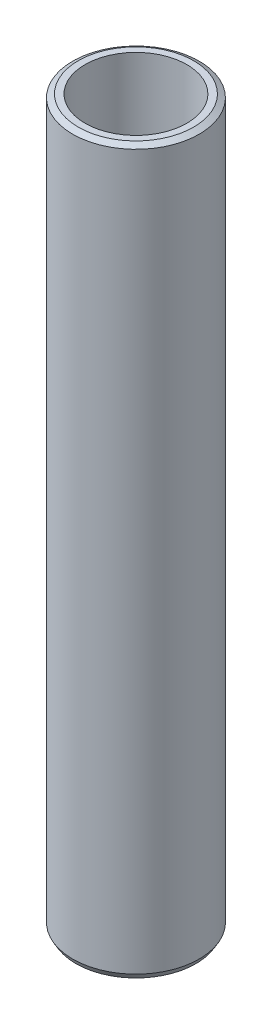
from build123d import *
from OCP.BRepFilletAPI import BRepFilletAPI_MakeChamfer

# Parameters (mm, degrees)
SKETCH1_R           = 52.5
BOSS_EXTRUDE1_DEPTH = 600
SKETCH2_R           = 42.214753031
CUT_EXTRUDE1_DEPTH  = 605.576297914
CHAMFER1_SIZE       = 2.701675338
CHAMFER1_SIZE2      = 4.679438951


with BuildPart() as part:
    # Sketch1 → Boss-Extrude1 (new body)
    with BuildSketch(Plane(origin=(0, 0, 0), x_dir=(1, 0, 0), z_dir=(0, 1, 0))):
        Circle(SKETCH1_R)
    extrude(amount=BOSS_EXTRUDE1_DEPTH)

    # Sketch2 → Cut-Extrude1 (cut, through all)
    with BuildSketch(Plane(origin=(0, 0, 0), x_dir=(1, 0, 0), z_dir=(0, 1, 0))):
        Circle(SKETCH2_R)
    extrude(amount=CUT_EXTRUDE1_DEPTH, mode=Mode.SUBTRACT)

    # Chamfer1: one chamfer whose edges measure the first distance from different faces: ONE call of the kernel's chamfer builder (chamfer() names one face for all edges)
    chamfer1_edges_1 = [part.edges().sort_by_distance(p)[0] for p in [
        (-52.5, 600, 0),
    ]]
    chamfer1_side_1 = [part.faces().sort_by_distance(p)[0] for p in [
        (-52.5, 300, 0),
    ]]
    chamfer1_edges_2 = [part.edges().sort_by_distance(p)[0] for p in [
        (-52.5, 0, 0),
    ]]
    chamfer1_side_2 = [part.faces().sort_by_distance(p)[0] for p in [
        (-51.01507576, 0, 0),
    ]]
    chamfer1 = BRepFilletAPI_MakeChamfer(part.part.solid().wrapped)
    for e in chamfer1_edges_1:
        chamfer1.Add(CHAMFER1_SIZE, CHAMFER1_SIZE2, e.wrapped, chamfer1_side_1[0].wrapped)  # the first distance lies on this face
    for e in chamfer1_edges_2:
        chamfer1.Add(CHAMFER1_SIZE, CHAMFER1_SIZE2, e.wrapped, chamfer1_side_2[0].wrapped)  # the first distance lies on this face
    add(Compound.cast(chamfer1.Shape()), mode=Mode.REPLACE)


solid = part.part
